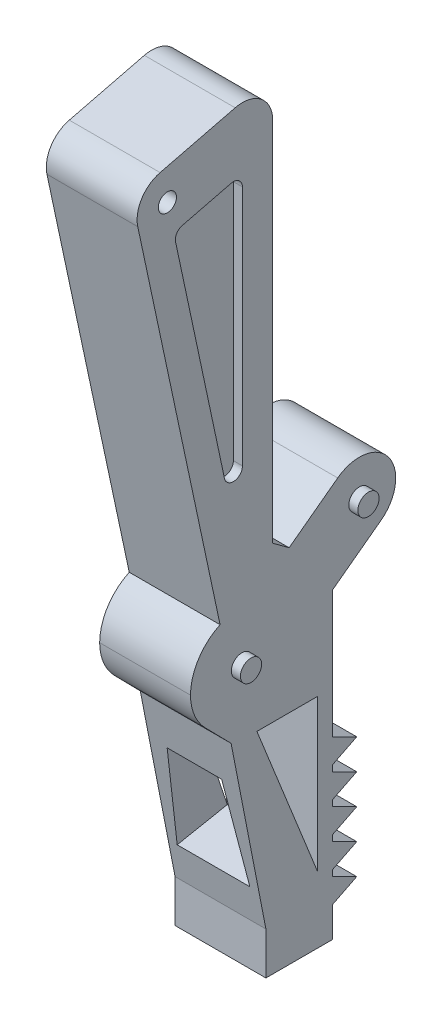
from build123d import *

# Parameters (mm, degrees)
BOSS_EXTRUDE1_DEPTH = 7.5
BOSS_EXTRUDE2_DEPTH = 15
LPATTERN1_COUNT     = 5
LPATTERN1_PITCH     = 5
CUT_EXTRUDE1_DEPTH  = 132.304814948
FILLET1_R           = 8.5
FILLET2_R           = 5
SKETCH4_R           = 1.5
CUT_EXTRUDE2_DEPTH  = 130.82329799
CUT_EXTRUDE3_REACH  = 131.114
SKETCH6_R           = 1.75
BOSS_EXTRUDE3_DEPTH = 1.5
SKETCH7_R           = 1.75
BOSS_EXTRUDE4_DEPTH = 1.5
CUT_EXTRUDE4_DEPTH  = 1.5


with BuildPart() as part:
    # Sketch1 → Boss-Extrude1 (new, symmetric)
    with BuildSketch(Plane(origin=(0, 0, 0), x_dir=(0, 0, -1), z_dir=(1, 0, 0))):
        with BuildLine():
            Line((1.125844004, 128.547240234), (-22.171185278, 122.781095368))
            Line((-22.171185278, 122.781095368), (-7.570249068, 54.320795472))
            Line((-7.570249068, 54.320795472), (-12.460270489, 53.277871457))
            Line((-12.460270489, 53.277871457), (-12.460270489, 43.277871457))
            Line((-12.460270489, 43.277871457), (-5.749067667, 36.443984461))
            Line((-5.749067667, 36.443984461), (0, 7))
            Line((0, 7), (0, 0))
            Line((0, 0), (11, 0))
            Line((11, 0), (11, 50))
            Line((11, 50), (19.022755483, 55.969538882))
            ThreePointArc((19.022755483, 55.969538882), (20.254685443, 64.364915501), (11.859308824, 65.596845461))
            Line((11.859308824, 65.596845461), (3.836553342, 59.627306579))
            Line((3.836553342, 59.627306579), (1.125844004, 61.629450689))
            Line((1.125844004, 61.629450689), (1.125844004, 128.547240234))
        make_face()
    extrude(amount=BOSS_EXTRUDE1_DEPTH, both=True)

    # Sketch2 → Boss-Extrude2 (add)
    with BuildSketch(Plane(origin=(7.5, 0, 0), x_dir=(0, 0, -1), z_dir=(1, 0, 0))):
        Polygon((11, 5), (15, 7), (11, 9), align=None)
    boss_extrude2 = extrude(amount=-BOSS_EXTRUDE2_DEPTH)

    # LPattern1: Boss-Extrude2 ×5
    with Locations(*[(0, i * LPATTERN1_PITCH, 0) for i in range(1, LPATTERN1_COUNT)]):
        add(boss_extrude2)

    # Sketch3 → Cut-Extrude1 (cut, through all)
    with BuildSketch(Plane(origin=(7.5, 0, 0), x_dir=(0, 0, -1), z_dir=(1, 0, 0))):
        Polygon((8.514249155, 11.015619925), (8.514249155, 36.015619925), (-1.485750845, 36.015619925), align=None)
    extrude(amount=-CUT_EXTRUDE1_DEPTH, mode=Mode.SUBTRACT)

    # Fillet1
    # the kernel refuses this fillet: 8.5 mm, written as the material it takes off along each edge
    with BuildSketch(Plane(origin=(-16.189504631, 43.277871457, 12.460270489), x_dir=(0, 1, 0), z_dir=(1, 0, 0))) as fillet1_piece_1:
        with BuildLine():
            CenterArc((FILLET1_R * 0.408917864968, -FILLET1_R), FILLET1_R, 90, 44.481059687)
            Line((-FILLET1_R * 0.29175558125, -FILLET1_R * 0.286517889667), (-FILLET1_R * 0.305769050174, -FILLET1_R * 0.27224824746))
            Line((-FILLET1_R * 0.305769050174, -FILLET1_R * 0.27224824746), (-FILLET1_R * 0.00817835729936, FILLET1_R * 0.02))
            Line((-FILLET1_R * 0.00817835729936, FILLET1_R * 0.02), (FILLET1_R * 0.408917864968, FILLET1_R * 0.02))
            Line((FILLET1_R * 0.408917864968, FILLET1_R * 0.02), (FILLET1_R * 0.408917864968, 0))
        make_face()
    extrude(amount=32.379009261, mode=Mode.SUBTRACT)
    with BuildSketch(Plane(origin=(-24.131006979, 53.277871457, 12.460270489), x_dir=(0, 0.20858480299843193, -0.9780042842227765), z_dir=(1, 0, 0))) as fillet1_piece_2:
        with BuildLine():
            CenterArc((6.92544629, -8.279049256), FILLET1_R, 103.092457682, 64.868111345)
            Line((-1.387590126, -6.506078431), (-1.553850854, -6.470619014))
            Line((-1.553850854, -6.470619014), (-0.166260728, 0.035459417))
            Line((-0.166260728, 0.035459417), (0, 0.17))
            ThreePointArc((0, 0.17), (2.5, 0.17), (4.961491074, 0.165580985))
            Line((4.961491074, 0.165580985), (5, 0))
        make_face()
    extrude(amount=48.262013958, mode=Mode.SUBTRACT)

    # Fillet2
    fillet2_edges = [part.edges().sort_by_distance(p)[0] for p in [
        (0, 122.781095368, 22.171185278),
        (0, 128.547240234, -1.125844004),
    ]]
    fillet(fillet2_edges, radius=FILLET2_R)

    # Sketch4 → Cut-Extrude2 (cut, through all)
    with BuildSketch(Plane(origin=(7.5, 0, 0), x_dir=(0, 0, -1), z_dir=(1, 0, 0))):
        with Locations((-16.271597688, 119.090404926)):
            Circle(SKETCH4_R)
    extrude(amount=-CUT_EXTRUDE2_DEPTH, mode=Mode.SUBTRACT)

    # Cut-Extrude3: up to this plane
    cut_extrude3_end = Plane(origin=(-7.5, 36.015619925, 1.485750845), z_dir=(0, -0.3713906763541038, 0.9284766908852593))
    # Sketch5 → Cut-Extrude3 (cut, up to the surface)
    with BuildSketch(Plane(origin=(0, 0.257069393, -1.316586904), x_dir=(1, 0, 0), z_dir=(0, -0.19163558890630344, 0.9814661487104557)), mode=Mode.PRIVATE) as cut_extrude3_sk1:
        Polygon((4.5, 29.370263041), (-4.5, 29.370263041), (-6, 12.858555839), (6, 12.858555839), align=None)
    cut_extrude3_tool1 = split(extrude(cut_extrude3_sk1.sketch, amount=-CUT_EXTRUDE3_REACH, mode=Mode.PRIVATE), bisect_by=cut_extrude3_end, keep=Keep.BOTH, mode=Mode.PRIVATE)
    add(cut_extrude3_tool1.solids().sort_by_distance((0, 20.594298, 2.654347))[0], mode=Mode.SUBTRACT)

    # Sketch6 → Boss-Extrude3 (add)
    with BuildSketch(Plane(origin=(7.5, 0, 0), x_dir=(0, 0, -1), z_dir=(1, 0, 0))):
        with Locations(Location((15.441032154, 60.783192172, 0), (0, 0, 180))):
            Circle(SKETCH6_R)
    boss_extrude3 = extrude(amount=BOSS_EXTRUDE3_DEPTH)

    # Sketch7 → Boss-Extrude4 (add)
    with BuildSketch(Plane(origin=(7.5, 0, 0), x_dir=(0, 0, -1), z_dir=(1, 0, 0))):
        with Locations(Location((-3.960270489, 46.753673309, 0), (0, 0, 180))):
            Circle(SKETCH7_R)
    boss_extrude4 = extrude(amount=BOSS_EXTRUDE4_DEPTH)

    # Sketch8 → Cut-Extrude4 (cut)
    with BuildSketch(Plane(origin=(7.5, 0, 0), x_dir=(0, 0, -1), z_dir=(1, 0, 0))):
        with BuildLine():
            Line((-14.925252721, 112.777715187), (-6.841162422, 74.873348079))
            ThreePointArc((-6.841162422, 74.873348079), (-5.216849988, 73.694496481), (-3.874155996, 75.186225283))
            Line((-3.874155996, 75.186225283), (-3.874155996, 115.091449891))
            ThreePointArc((-3.874155996, 115.091449891), (-4.449649663, 116.272673004), (-5.73454005, 116.547514222))
            Line((-5.73454005, 116.547514222), (-13.818630348, 114.546656721))
            ThreePointArc((-13.818630348, 114.546656721), (-14.729909587, 113.886125212), (-14.925252721, 112.777715187))
        make_face()
    cut_extrude4 = extrude(amount=-CUT_EXTRUDE4_DEPTH, mode=Mode.SUBTRACT)

    # Mirror1: Boss-Extrude3, Boss-Extrude4, Cut-Extrude4 across plane
    add(boss_extrude3.mirror(Plane(origin=(0, 0, 0), x_dir=(0, 0, 1), z_dir=(1, 0, 0))))
    add(boss_extrude4.mirror(Plane(origin=(0, 0, 0), x_dir=(0, 0, 1), z_dir=(1, 0, 0))))
    add(cut_extrude4.mirror(Plane(origin=(0, 0, 0), x_dir=(0, 0, 1), z_dir=(1, 0, 0))), mode=Mode.SUBTRACT)


solid = part.part
